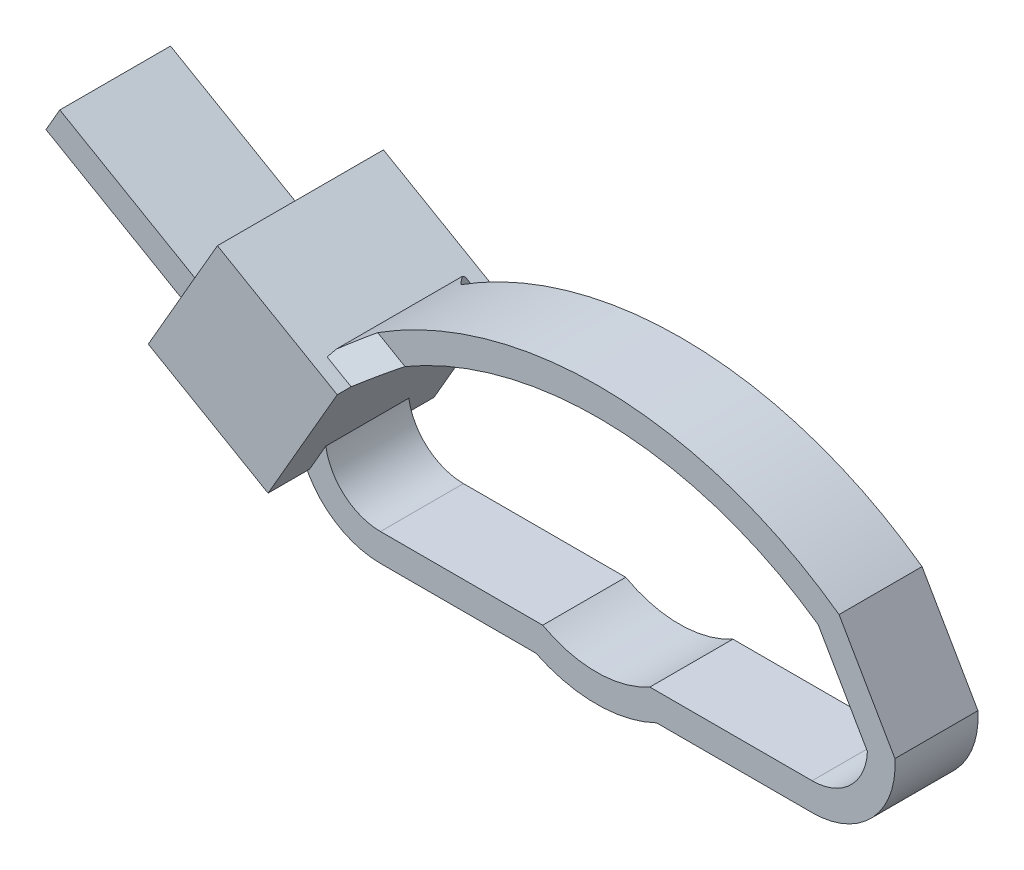
from build123d import *

# Parameters (mm, degrees)
BOSS_EXTRUDE2_DEPTH = 1.5
BOSS_EXTRUDE3_DEPTH = 3
SKETCH2_W           = 4
SKETCH2_H           = 1
BOSS_EXTRUDE4_DEPTH = 6
SKETCH2_3_W         = 4
SKETCH2_3_H         = 2
CUT_EXTRUDE1_DEPTH  = 1
CHAMFER1_SIZE       = 1


with BuildPart() as part:
    # Sketch1 → Boss-Extrude2 (new, symmetric)
    with BuildSketch(Plane.XY):
        with BuildLine():
            Line((-7.8, 6), (-2.179449472, 6))
            ThreePointArc((-2.179449472, 6), (0, 5.5), (2.179449472, 6))
            Line((2.179449472, 6), (7.8, 6))
            ThreePointArc((7.8, 6), (9.987434844, 6.946922115), (10.793982736, 9.189914132))
            Line((10.793982736, 9.189914132), (8.773900958, 12.688798406))
            ThreePointArc((8.773900958, 12.688798406), (0.077350269, 15.500303533), (-8.61920042, 12.688798406))
            Line((-8.61920042, 12.688798406), (-8.72820323, 12.5))
            Line((-8.72820323, 12.5), (-7.862177826, 12))
            ThreePointArc((-7.862177826, 12), (0.077350269, 14.500303533), (8.016878365, 12))
            Line((8.016878365, 12), (9.798179943, 8.914695163))
            ThreePointArc((9.798179943, 8.914695163), (9.183725104, 7.55594154), (7.8, 7))
            Line((7.8, 7), (1.936491673, 7))
            ThreePointArc((1.936491673, 7), (0, 6.5), (-1.936491673, 7))
            Line((-1.936491673, 7), (-7.8, 7))
            ThreePointArc((-7.8, 7), (-9.098627684, 7.478958864), (-9.775266128, 8.686433862))
            Line((-9.775266128, 8.686433862), (-10.362177826, 7.669872981))
            Line((-10.362177826, 7.669872981), (-10.536485592, 7.770509617))
            ThreePointArc((-10.536485592, 7.770509617), (-9.429651627, 6.481223397), (-7.8, 6))
        make_face()
    extrude(amount=BOSS_EXTRUDE2_DEPTH, both=True)

    # Sketch1<5> → Boss-Extrude3 (add, symmetric)
    with BuildSketch(Plane.XY):
        with BuildLine():
            Line((-14.692304845, 10.169872981), (-10.536485592, 7.770509617))
            ThreePointArc((-10.536485592, 7.770509617), (-10.724033666, 8.329159391), (-10.798758273, 8.913693465))
            Line((-10.798758273, 8.913693465), (-8.72820323, 12.5))
            Line((-8.72820323, 12.5), (-12.192304845, 14.5))
            Line((-12.192304845, 14.5), (-14.692304845, 10.169872981))
        make_face()
        with BuildLine():
            ThreePointArc((-10.798758273, 8.913693465), (-10.724033666, 8.329159391), (-10.536485592, 7.770509617))
            Line((-10.536485592, 7.770509617), (-10.362177826, 7.669872981))
            Line((-10.362177826, 7.669872981), (-9.775266128, 8.686433862))
            Line((-9.775266128, 8.686433862), (-7.862177826, 12))
            Line((-7.862177826, 12), (-8.72820323, 12.5))
            Line((-8.72820323, 12.5), (-10.798758273, 8.913693465))
        make_face()
    extrude(amount=BOSS_EXTRUDE3_DEPTH, both=True)

    # Sketch2 → Boss-Extrude4 (add)
    with BuildSketch(Plane(origin=(-15.422912811, 8.904422863, 0), x_dir=(0, 0, 1), z_dir=(-0.8660254037844408, 0.4999999999999963, 0))):
        with Locations((0, 2.961215932)):
            Rectangle(SKETCH2_W, SKETCH2_H)
    extrude(amount=BOSS_EXTRUDE4_DEPTH)

    # Sketch2<3> → Cut-Extrude1 (cut)
    with BuildSketch(Plane(origin=(-15.422912811, 8.904422863, 0), x_dir=(0, 0, 1), z_dir=(-0.8660254037844408, 0.4999999999999963, 0))):
        with Locations((0, 4.461215932)):
            Rectangle(SKETCH2_3_W, SKETCH2_3_H)
    extrude(amount=-CUT_EXTRUDE1_DEPTH, mode=Mode.SUBTRACT)

    # Chamfer1
    # the kernel refuses this chamfer: 1 mm, written as the material it adds along each edge
    with BuildSketch(Plane(origin=(-8.72820323, 12.5, -1.5), x_dir=(0.4998109584556448, 0.8656979742248824, 0.027495876610586233), z_dir=(0.8660254037844407, -0.4999999999999965, 0))) as chamfer1_piece_1_section:
        Polygon((CHAMFER1_SIZE * 0.999621916911, -CHAMFER1_SIZE * 0.0274958766106), (-CHAMFER1_SIZE * 0.0274958766106, -CHAMFER1_SIZE * 0.999621916911), (0, 0), align=None)
    chamfer1_piece_1 = extrude(amount=1, mode=Mode.PRIVATE)
    chamfer1_piece_1 = chamfer1_piece_1 & Plane(origin=(0.077350269, 0.64446099, -1.842899674), x_dir=(0.5853959924126673, 0.8107475143762012, 0), z_dir=(0, 0, 1)) * Cylinder(14.855842544, 6, mode=Mode.PRIVATE)
    chamfer1_piece_1 = chamfer1_piece_1 - Plane(origin=(0.077350269, 0.64446099, -1.842899674), x_dir=(-0.5730094052913434, 0.8195487913770974, 0), z_dir=(0, 0, 1)) * Cylinder(13.855842544, 6, mode=Mode.PRIVATE)
    add(chamfer1_piece_1)
    with BuildSketch(Plane(origin=(-8.72820323, 12.5, -1.5), x_dir=(0.4998109584556448, 0.8656979742248824, 0.027495876610586233), z_dir=(0.8660254037844407, -0.4999999999999965, 0))) as chamfer1_piece_2_section:
        Polygon((CHAMFER1_SIZE * 0.999621916911, -CHAMFER1_SIZE * 0.0274958766106), (-CHAMFER1_SIZE * 0.0274958766106, -CHAMFER1_SIZE * 0.999621916911), (0, 0), align=None)
    chamfer1_piece_2 = extrude(amount=3.571682988, mode=Mode.PRIVATE)
    chamfer1_piece_2 = split(chamfer1_piece_2, bisect_by=Plane(origin=(-7.598721959, 12.456318948, -1.72489745), z_dir=(0.8660254037844384, -0.5000000000000004, 0)), keep=Keep.TOP, mode=Mode.PRIVATE)
    chamfer1_piece_2 = chamfer1_piece_2 - Plane(origin=(0.077350269, 0.64446099, -1.72489745), x_dir=(-0.5730094052913434, 0.8195487913770974, 0), z_dir=(0, 0, 1)) * Cylinder(13.855842544, 12, mode=Mode.PRIVATE)
    add(chamfer1_piece_2)
    with BuildSketch(Plane(origin=(-8.72820323, 12.5, 1.5), x_dir=(0.4998109584556448, 0.8656979742248824, -0.027495876610586233), z_dir=(0.8660254037844407, -0.4999999999999965, 0))) as chamfer1_piece_3_section:
        Polygon((CHAMFER1_SIZE * 0.999621916911, CHAMFER1_SIZE * 0.0274958766106), (-CHAMFER1_SIZE * 0.0274958766106, CHAMFER1_SIZE * 0.999621916911), (0, 0), align=None)
    chamfer1_piece_3 = extrude(amount=1, mode=Mode.PRIVATE)
    chamfer1_piece_3 = chamfer1_piece_3 & Plane(origin=(0.077350269, 0.64446099, 1.842899674), x_dir=(0.5853959924126673, 0.8107475143762012, 0), z_dir=(0, 0, 1)) * Cylinder(14.855842544, 6, mode=Mode.PRIVATE)
    chamfer1_piece_3 = chamfer1_piece_3 - Plane(origin=(0.077350269, 0.64446099, 1.842899674), x_dir=(-0.5730094052913434, 0.8195487913770974, 0), z_dir=(0, 0, 1)) * Cylinder(13.855842544, 6, mode=Mode.PRIVATE)
    add(chamfer1_piece_3)
    with BuildSketch(Plane(origin=(-8.72820323, 12.5, 1.5), x_dir=(0.4998109584556448, 0.8656979742248824, -0.027495876610586233), z_dir=(0.8660254037844407, -0.4999999999999965, 0))) as chamfer1_piece_4_section:
        Polygon((CHAMFER1_SIZE * 0.999621916911, CHAMFER1_SIZE * 0.0274958766106), (-CHAMFER1_SIZE * 0.0274958766106, CHAMFER1_SIZE * 0.999621916911), (0, 0), align=None)
    chamfer1_piece_4 = extrude(amount=3.571682988, mode=Mode.PRIVATE)
    chamfer1_piece_4 = split(chamfer1_piece_4, bisect_by=Plane(origin=(-7.598721959, 12.456318948, 1.72489745), z_dir=(0.8660254037844384, -0.5000000000000004, 0)), keep=Keep.TOP, mode=Mode.PRIVATE)
    chamfer1_piece_4 = chamfer1_piece_4 - Plane(origin=(0.077350269, 0.64446099, 1.72489745), x_dir=(-0.5730094052913434, 0.8195487913770974, 0), z_dir=(0, 0, 1)) * Cylinder(13.855842544, 12, mode=Mode.PRIVATE)
    add(chamfer1_piece_4)


solid = part.part
